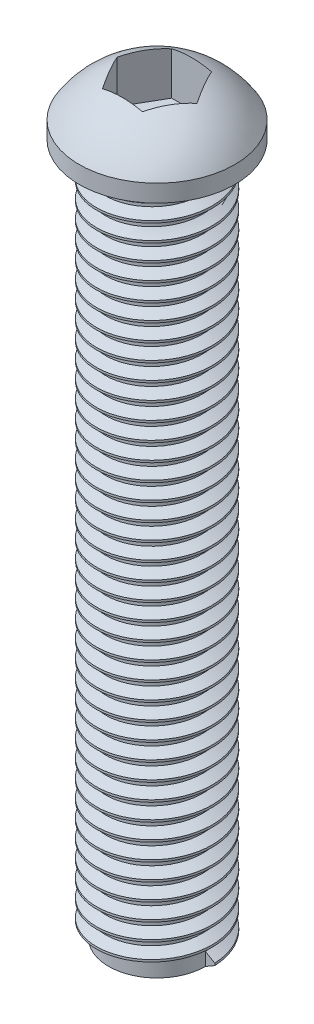
from build123d import *

# Parameters (mm, degrees)
SKETCH1_R           = 1.4
BOSS_EXTRUDE1_DEPTH = 20
CUT_EXTRUDE1_START  = 1.75
CUT_EXTRUDE1_DEPTH  = 1.5
THREAD2_PITCH       = 0.5


with BuildPart() as part:
    # Sketch1 → Boss-Extrude1 (new body)
    with BuildSketch(Plane(origin=(0, 0, 0), x_dir=(1, 0, 0), z_dir=(0, 1, 0))):
        with Locations(Location((0, 0, 0), (0, 0, 270))):
            Circle(SKETCH1_R)
    extrude(amount=-BOSS_EXTRUDE1_DEPTH)

    # Sketch2 → Revolve1 (revolve)
    with BuildSketch(Plane.XY):
        with BuildLine():
            Line((0, 0), (2.25, 0))
            Line((2.25, 0), (2.25, 0.5))
            ThreePointArc((2.25, 0.5), (1.286953768, 1.416516782), (0, 1.75))
            Line((0, 1.75), (0, 0))
        make_face()
    revolve(axis=Axis((0, 0, 0), (0, 1, 0)))

    # Sketch3 → Cut-Extrude1 (cut)
    with BuildSketch(Plane(origin=(0, 0, 0), x_dir=(1, 0, 0), z_dir=(0, 1, 0)).offset(CUT_EXTRUDE1_START)):
        Polygon((1.154700538, 0), (0.577350269, 1), (-0.577350269, 1), (-1.154700538, 0), (-0.577350269, -1), (0.577350269, -1), align=None)
    extrude(amount=-CUT_EXTRUDE1_DEPTH, mode=Mode.SUBTRACT)

    # Thread2: the profile of Thread Profile2 profile screwed along a right-hand helix of 40 turns, 6 arcs to a turn; built about Z, then put on its axis
    thread2_z = Axis((0, 0, 0), (0, 0, 1))
    thread2_corners = [(1.3997, 0, -0.000173205), (1.670632937, 0, 0.156249999), (1.670632937, 0, 0.218749999), (1.3997, 0, 0.375173204)]
    with BuildLine(mode=Mode.PRIVATE) as thread2_profile:
        Line(thread2_corners[0], thread2_corners[1])
        Line(thread2_corners[1], thread2_corners[2])
        Line(thread2_corners[2], thread2_corners[3])
        Line(thread2_corners[3], thread2_corners[0])
    thread2_cap = Face(thread2_profile.wire())
    thread2_turn_angles = [0, 30, 60, 90, 120, 150, 180, 210, 240, 270, 300, 330, 360, 390, 420, 450, 480, 510, 540, 570, 600, 630, 660, 690, 720]
    thread2_turn_weights = [1, 0.8660254037844387, 1, 0.8660254037844387, 1, 0.8660254037844387, 1, 0.8660254037844387, 1, 0.8660254037844387, 1, 0.8660254037844387, 1, 0.8660254037844387, 1, 0.8660254037844387, 1, 0.8660254037844387, 1, 0.8660254037844387, 1, 0.8660254037844387, 1, 0.8660254037844387, 1]
    thread2_turn_rails = [Edge.make_bspline([Vector(p[0], p[1], 0).rotate(thread2_z, thread2_turn_angles[k]) / thread2_turn_weights[k] + Vector(0, 0, p[2] + THREAD2_PITCH * thread2_turn_angles[k] / 360) for k in range(25)], [0, 0, 0, 1, 1, 2, 2, 3, 3, 4, 4, 5, 5, 6, 6, 7, 7, 8, 8, 9, 9, 10, 10, 11, 11, 12, 12, 12], 2, thread2_turn_weights) for p in thread2_corners]
    thread2_turn_sides = [Face.make_surface_from_curves(thread2_turn_rails[p[0]], thread2_turn_rails[p[1]]) for p in [(0, 1), (1, 2), (2, 3), (3, 0)]]
    thread2 = Plane(origin=(0, -20, 0), x_dir=(1, 0, 0), z_dir=(0, 1, 0)) * Solid(Shell([*[p.moved(Location((0, 0, 2 * THREAD2_PITCH * i))) for i in range(20) for p in thread2_turn_sides], thread2_cap, thread2_cap.rotate(thread2_z, 14400).moved(Location((0, 0, THREAD2_PITCH * 14400 / 360)))]))
    add(thread2)


solid = part.part
